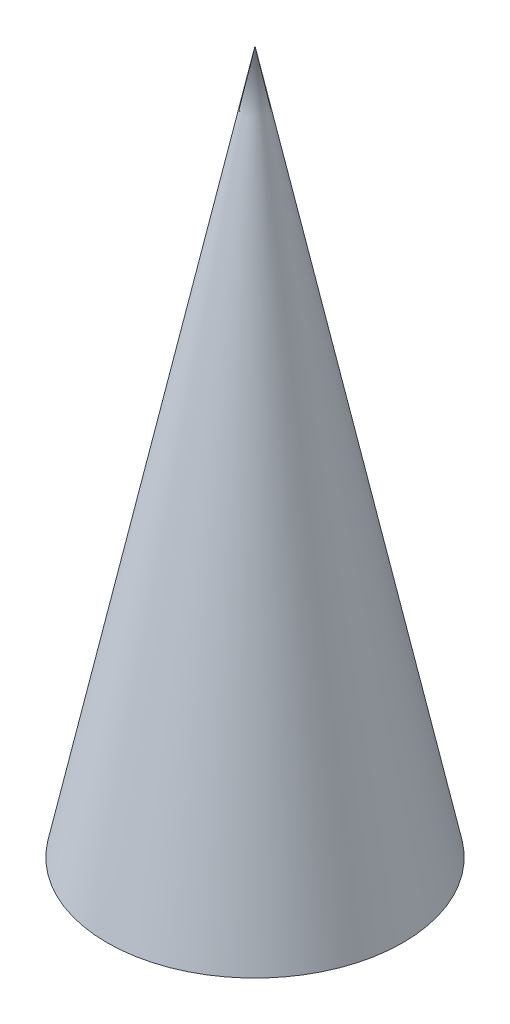
from build123d import *

# Parameters (mm, degrees)
SKETCH_1_R       = 40
EXTRUDE_2_DEPTH  = 190
CHAMFER_1_SIZE   = 190
CHAMFER_1_SIZE_2 = 40


with BuildPart() as part:
    # Эскиз1 → Вытянуть2 (new body)
    with BuildSketch(Plane(origin=(0, 0, 0), x_dir=(1, 0, 0), z_dir=(0, 1, 0))):
        with Locations(Location((0, 0, 0), (0, 0, 270))):
            Circle(SKETCH_1_R)
    extrude(amount=EXTRUDE_2_DEPTH)

    # Фаска1
    # the kernel refuses this chamfer: 190, 40 mm, written as the material it takes off along each edge
    with BuildSketch(Plane(origin=(0, 190, 0), x_dir=(0, 0, 1), z_dir=(-1, 0, 0))) as chamfer_1_piece_1:
        Polygon((40, -CHAMFER_1_SIZE), (40 - CHAMFER_1_SIZE_2, 0), (40, 0), align=None)
    revolve(axis=Axis((0, 190, 0), (0, 1, 0)), mode=Mode.SUBTRACT)


solid = part.part
